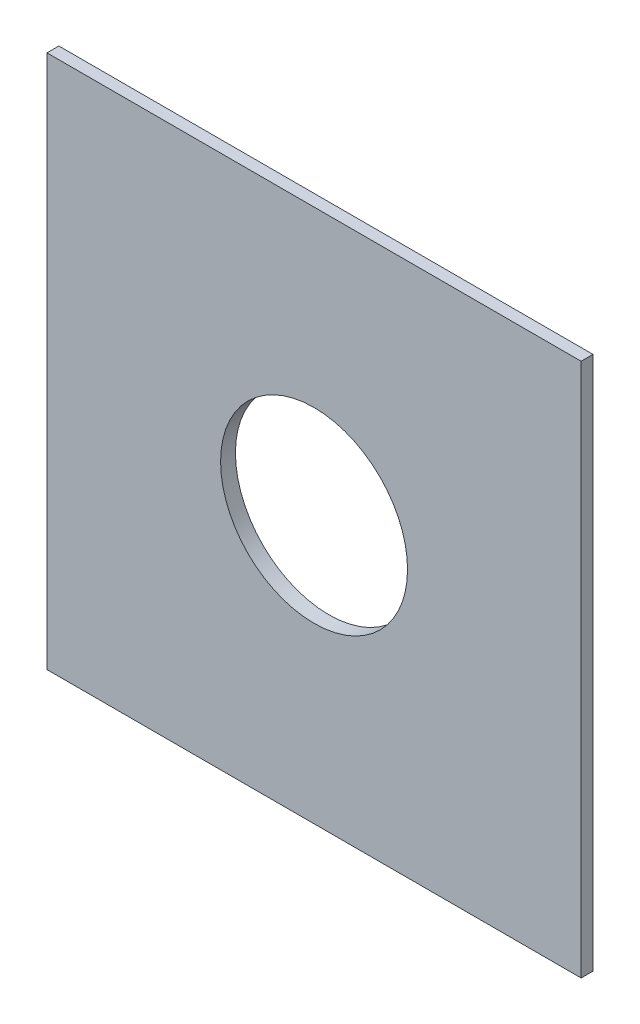
from build123d import *
from build123d.topology import SkipClean

# Parameters (mm, degrees)
SKETCH1_W           = 180
SKETCH1_H           = 180
SKETCH1_R           = 31.5
BOSS_EXTRUDE1_DEPTH = 4
BOSS_EXTRUDE2_DEPTH = 2
SKETCH6_3_R         = 38.5
SKETCH6_3_R_2       = 31.5
BOSS_EXTRUDE3_DEPTH = 1


with BuildPart() as part:
    # Sketch1 → Boss-Extrude1 (new body)
    with BuildSketch(Plane.XY):
        Rectangle(SKETCH1_W, SKETCH1_H)
        Circle(SKETCH1_R, mode=Mode.SUBTRACT)
    extrude(amount=-BOSS_EXTRUDE1_DEPTH)

    # Sketch6 → Boss-Extrude2 (add)
    with BuildSketch(Plane(origin=(0, 0, -4), x_dir=(-1, 0, 0), z_dir=(0, 0, -1))):
        Polygon((55, 22.781745931), (22.781745931, 55), (-22.781745931, 55), (-55, 22.781745931), (-55, -22.781745931), (-22.781745931, -55), (22.781745931, -55), (55, -22.781745931), align=None)
        Polygon((-21.539105243, -52), (-52, -21.539105243), (-52, 21.539105243), (-21.539105243, 52), (21.539105243, 52), (52, 21.539105243), (52, -21.539105243), (21.539105243, -52), align=None, mode=Mode.SUBTRACT)
    extrude(amount=BOSS_EXTRUDE2_DEPTH)

    # Sketch6<3> → Boss-Extrude3 (add)
    with SkipClean():  # the faces are left unmerged after this step: merging them gives an invalid solid
        with BuildSketch(Plane(origin=(0, 0, -4), x_dir=(-1, 0, 0), z_dir=(0, 0, -1))):
            Circle(SKETCH6_3_R)
            Circle(SKETCH6_3_R_2, mode=Mode.SUBTRACT)
        extrude(amount=BOSS_EXTRUDE3_DEPTH)
    add(part.part.scale(1), mode=Mode.REPLACE)  # the faces are merged on a copy


solid = part.part
